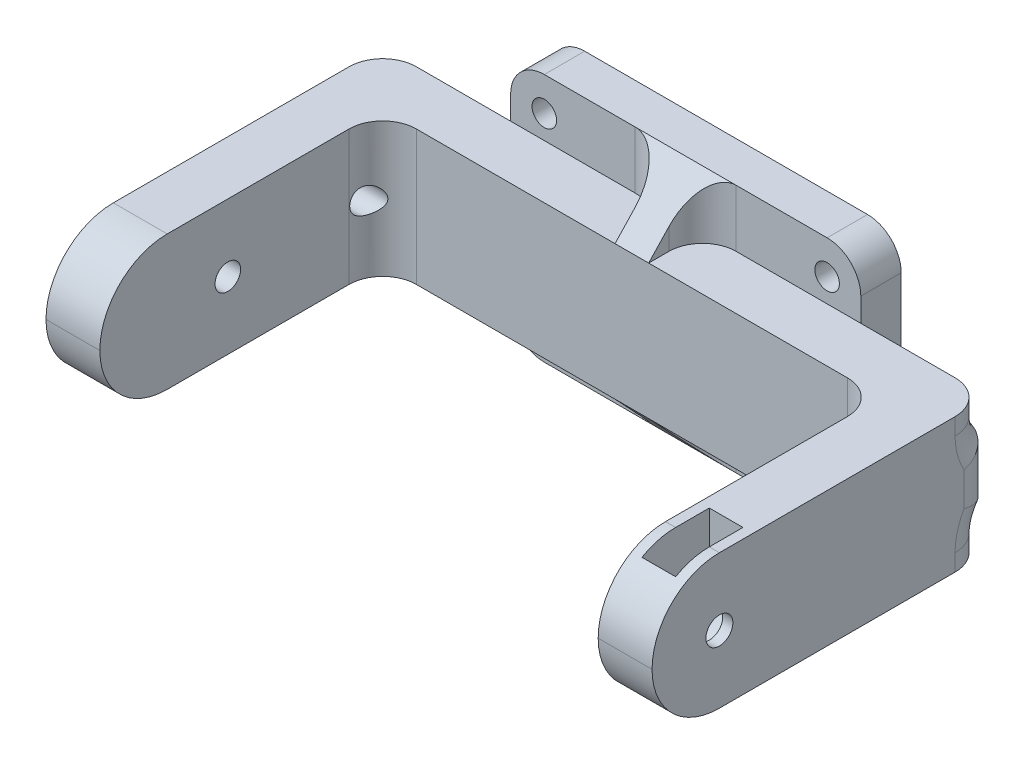
from build123d import *

# Parameters (mm, degrees)
BOSS_EXTRU_1_DEPTH      = 5
ESQUISSE4_W             = 2.5
ESQUISSE4_H             = 5
ENL_V_MAT_EXTRU_1_DEPTH = 7.5
ENL_V_MAT_EXTRU_2_REACH = 51.497
ESQUISSE5_R             = 1
CONG_1_R                = 2.5
CONG_2_R                = 5
ESQUISSE6_W             = 26
ESQUISSE6_H             = 18.5
ESQUISSE6_R             = 0.91
BOSS_EXTRU_2_DEPTH      = 3
NERVURE4_REACH          = 35.479
ESQUISSE7_WALL_W        = 74.793384568
ESQUISSE7_WALL_H        = 2.5
NERVURE5_REACH          = 35.479
ESQUISSE8_WALL_W        = 78.919505224
ESQUISSE8_WALL_H        = 2.5
CONG_3_R                = 2.5
CONG_4_START            = -2.015218214
CONG_4_3_DEPTH          = 4.030436428
CONG_4_START_2          = 3.7499999
CONG_4_4_DEPTH          = 1.2500001
CONG_4_START_3          = -5
CONG_4_5_DEPTH          = 1.25
CONG_4_6_DEPTH          = 10
ENL_V_MAT_EXTRU_3_REACH = 53.377
ESQUISSE9_R             = 0.95


with BuildPart() as part:
    # Esquisse2 → Boss.-Extru.1 (new, symmetric)
    with BuildSketch(Plane(origin=(0, 0, 0), x_dir=(1, 0, 0), z_dir=(0, 1, 0))):
        Polygon((-18.5, -5), (-18.5, 16), (18.5, 16), (18.5, -5), (22.5, -5), (22.5, 20), (-22.5, 20), (-22.5, -5), align=None)
    extrude(amount=BOSS_EXTRU_1_DEPTH, both=True)

    # Esquisse4 → Enlèv. mat.-Extru.1 (cut)
    with BuildSketch(Plane(origin=(0, 5, 0), x_dir=(1, 0, 0), z_dir=(0, 1, 0))):
        with Locations((20.5, 0)):
            Rectangle(ESQUISSE4_W, ESQUISSE4_H)
    extrude(amount=-ENL_V_MAT_EXTRU_1_DEPTH, mode=Mode.SUBTRACT)

    # Enlèv. mat.-Extru.2: up to this face of the body (flat: up to its plane)
    enl_v_mat_extru_2_end = Plane(part.part.faces().sort_by_distance((18.5, 0, -5.5))[0])
    # Esquisse5 → Enlèv. mat.-Extru.2 (cut, up to the picked face)
    with BuildSketch(Plane(origin=(22.5, 0, 0), x_dir=(0, 0, -1), z_dir=(1, 0, 0)), mode=Mode.PRIVATE) as enl_v_mat_extru_2_sk1:
        Circle(ESQUISSE5_R)
    enl_v_mat_extru_2_tool1 = split(extrude(enl_v_mat_extru_2_sk1.sketch, amount=-ENL_V_MAT_EXTRU_2_REACH, mode=Mode.PRIVATE), bisect_by=enl_v_mat_extru_2_end, keep=Keep.BOTH, mode=Mode.PRIVATE)
    add(enl_v_mat_extru_2_tool1.solids().sort_by(Axis((22.5, 0, 0), (-1, 0, 0)))[0], mode=Mode.SUBTRACT)

    # Congé1
    cong_1_edges = [part.edges().sort_by_distance(p)[0] for p in [
        (20.5, -2.5, 2.5),
        (20.5, -2.5, -2.5),
    ]]
    fillet(cong_1_edges, radius=CONG_1_R - 0.0001)  # a hair under: the kernel refuses the full size

    # Congé2
    # the kernel refuses this fillet: 5 mm, written as the material it takes off along each edge
    with BuildSketch(Plane(origin=(-35, -5, 5), x_dir=(0, 1, 0), z_dir=(1, 0, 0)), Plane(origin=(-35, 5, 5), x_dir=(0, 0, -1), z_dir=(1, 0, 0)), Plane(origin=(6, -5, 5), x_dir=(0, 1, 0), z_dir=(1, 0, 0)), Plane(origin=(6, 5, 5), x_dir=(0, 0, -1), z_dir=(1, 0, 0))) as cong_2_piece_1:
        with BuildLine():
            CenterArc((CONG_2_R, -CONG_2_R), CONG_2_R, 90, 90)
            Line((0, -CONG_2_R), (0, 0))
            Line((0, 0), (CONG_2_R, 0))
        make_face()
    extrude(amount=29, mode=Mode.SUBTRACT)

    # Esquisse6 → Boss.-Extru.2 (add)
    with BuildSketch(Plane(origin=(0, 0, -20), x_dir=(-1, 0, 0), z_dir=(0, 0, -1))):
        Rectangle(ESQUISSE6_W, ESQUISSE6_H)
        with Locations((-10.5, 6.75)):
            Circle(ESQUISSE6_R, mode=Mode.SUBTRACT)
        with Locations((10.5, 6.75)):
            Circle(ESQUISSE6_R, mode=Mode.SUBTRACT)
        with Locations((10.5, -6.75)):
            Circle(ESQUISSE6_R, mode=Mode.SUBTRACT)
        with Locations((-10.5, -6.75)):
            Circle(ESQUISSE6_R, mode=Mode.SUBTRACT)
    extrude(amount=BOSS_EXTRU_2_DEPTH)

    # Esquisse7 wall → Nervure4 (add, up to next)
    with BuildSketch(Plane(origin=(0, 7.125, -18), x_dir=(0, -0.728199992693, 0.685364699005), z_dir=(0, -0.685364699005, -0.728199992693)), mode=Mode.PRIVATE) as nervure4_sk1:
        Rectangle(ESQUISSE7_WALL_W, ESQUISSE7_WALL_H)
    nervure4_tool1 = extrude(nervure4_sk1.sketch, amount=NERVURE4_REACH, mode=Mode.PRIVATE) - part.part
    nervure4 = nervure4_tool1.solids().sort_by_distance((0, 7.125, -18))[0]
    add(nervure4)

    # Symétrie1: Nervure4 across plane
    add(nervure4.mirror(Plane.ZX))

    # Esquisse8 wall → Nervure5 (add, up to next)
    with BuildSketch(Plane(origin=(17.75, 0, -21.5), x_dir=(0.953582665134, 0, 0.301131367937), z_dir=(0.301131367937, 0, -0.953582665134)), mode=Mode.PRIVATE) as nervure5_sk1:
        Rectangle(ESQUISSE8_WALL_W, ESQUISSE8_WALL_H)
    nervure5_tool1 = extrude(nervure5_sk1.sketch, amount=-NERVURE5_REACH, mode=Mode.PRIVATE) - part.part
    nervure5 = nervure5_tool1.solids().sort_by_distance((17.75, 0, -21.5))[0]
    add(nervure5)

    # Symétrie2: Nervure5 across plane
    add(nervure5.mirror(Plane(origin=(0, 0, 0), x_dir=(0, 0, 1), z_dir=(1, 0, 0))))

    # Congé3
    cong_3_edges = [part.edges().sort_by_distance(p)[0] for p in [
        (1.25, 7.125, -20),
        (-1.25, 7.125, -20),
        (-1.25, -7.125, -20),
        (1.25, -7.125, -20),
        (17.75, 1.25, -20),
        (17.75, -1.25, -20),
        (-17.75, -1.25, -20),
        (-17.75, 1.25, -20),
        (-13, -9.25, -21.5),
        (-13, 9.25, -21.5),
        (13, 9.25, -21.5),
        (13, -9.25, -21.5),
    ]]
    fillet(cong_3_edges, radius=CONG_3_R)

    # Congé4: read off the stored shape, not the designer's step
    # Congé4 outline → Congé4 (revolve, cut)
    with BuildSketch(Plane(origin=(0, 3.75, -22.5), x_dir=(0, 1, 0), z_dir=(0, 0, -1))):
        with BuildLine():
            Line((2.5, 22.5), (2.5, 20))
            ThreePointArc((2.5, 20), (3.232233047, 21.767766953), (5, 22.5))
            Line((5, 22.5), (2.5, 22.5))
        make_face()
        with BuildLine():
            ThreePointArc((5, -22.5), (3.232233047, -21.767766953), (2.5, -20))
            Line((2.5, -20), (2.5, -22.5))
            Line((2.5, -22.5), (5, -22.5))
        make_face()
    revolve(axis=Axis((0, 3.75, -22.5), (1, 0, 0)), mode=Mode.SUBTRACT)

    # Cong_4 2 outline → Cong_4 2 (revolve, cut)
    with BuildSketch(Plane(origin=(0, -3.75, -22.5), x_dir=(0, 1, 0), z_dir=(0, 0, -1))):
        with BuildLine():
            Line((2.5, 22.5), (2.5, 20))
            ThreePointArc((2.5, 20), (3.232233047, 21.767766953), (5, 22.5))
            Line((5, 22.5), (2.5, 22.5))
        make_face()
        with BuildLine():
            ThreePointArc((5, -22.5), (3.232233047, -21.767766953), (2.5, -20))
            Line((2.5, -20), (2.5, -22.5))
            Line((2.5, -22.5), (5, -22.5))
        make_face()
    revolve(axis=Axis((0, -3.75, -22.5), (1, 0, 0)), mode=Mode.SUBTRACT)

    # Cong_4 3 outline → Cong_4 3 (cut)
    with BuildSketch(Plane(origin=(0, 0, 0), x_dir=(1, 0, 0), z_dir=(0, 1, 0)).offset(CONG_4_START)):
        with BuildLine():
            Line((22.5, 18.167781731), (22.5, 15.999999998))
            Line((22.5, 15.999999998), (24, 15.999999998))
            Line((24, 15.999999998), (24, 19.52631579))
            Line((24, 19.52631579), (22.449089048, 20.016077143))
            Line((22.449089048, 20.016077143), (20.75282842, 20.551738394))
            ThreePointArc((20.75282842, 20.551738394), (22.016441302, 19.645605968), (22.5, 18.167781731))
        make_face()
        with BuildLine():
            Line((-24, 15.999999998), (-22.5, 15.999999998))
            Line((-22.5, 15.999999998), (-22.5, 18.167781731))
            ThreePointArc((-22.5, 18.167781731), (-22.016441302, 19.645605968), (-20.75282842, 20.551738394))
            Line((-20.75282842, 20.551738394), (-22.449089048, 20.016077143))
            Line((-22.449089048, 20.016077143), (-24, 19.52631579))
            Line((-24, 19.52631579), (-24, 15.999999998))
        make_face()
    extrude(amount=CONG_4_3_DEPTH, mode=Mode.SUBTRACT)

    # Cong_4 4 outline → Cong_4 4 (cut)
    with BuildSketch(Plane(origin=(0, 0, 0), x_dir=(1, 0, 0), z_dir=(0, 1, 0)).offset(CONG_4_START_2)):
        with BuildLine():
            Line((18.5, 20), (20, 20))
            ThreePointArc((20, 20), (21.767766953, 19.267766953), (22.5, 17.5))
            Line((22.5, 17.5), (22.5, 18.167781731))
            ThreePointArc((22.5, 18.167781731), (22.016441302, 19.645605968), (20.75282842, 20.551738394))
            Line((20.75282842, 20.551738394), (18.5, 21.263157895))
            Line((18.5, 21.263157895), (18.5, 20))
        make_face()
        with BuildLine():
            Line((-18.5, 20), (-18.5, 21.263157895))
            Line((-18.5, 21.263157895), (-20.75282842, 20.551738394))
            ThreePointArc((-20.75282842, 20.551738394), (-22.016441302, 19.645605968), (-22.5, 18.167781731))
            Line((-22.5, 18.167781731), (-22.5, 17.5))
            ThreePointArc((-22.5, 17.5), (-21.767766953, 19.267766953), (-20, 20))
            Line((-20, 20), (-18.5, 20))
        make_face()
    extrude(amount=CONG_4_4_DEPTH, mode=Mode.SUBTRACT)

    # Cong_4 5 outline → Cong_4 5 (cut)
    with BuildSketch(Plane(origin=(0, 0, 0), x_dir=(1, 0, 0), z_dir=(0, 1, 0)).offset(CONG_4_START_3)):
        with BuildLine():
            Line((18.5, 20), (20, 20))
            ThreePointArc((20, 20), (21.767766953, 19.267766953), (22.5, 17.5))
            Line((22.5, 17.5), (22.5, 18.167781731))
            ThreePointArc((22.5, 18.167781731), (22.016441302, 19.645605968), (20.75282842, 20.551738394))
            Line((20.75282842, 20.551738394), (18.5, 21.263157895))
            Line((18.5, 21.263157895), (18.5, 20))
        make_face()
        with BuildLine():
            Line((-18.5, 20), (-18.5, 21.263157895))
            Line((-18.5, 21.263157895), (-20.75282842, 20.551738394))
            ThreePointArc((-20.75282842, 20.551738394), (-22.016441302, 19.645605968), (-22.5, 18.167781731))
            Line((-22.5, 18.167781731), (-22.5, 17.5))
            ThreePointArc((-22.5, 17.5), (-21.767766953, 19.267766953), (-20, 20))
            Line((-20, 20), (-18.5, 20))
        make_face()
    extrude(amount=CONG_4_5_DEPTH, mode=Mode.SUBTRACT)

    # Cong_4 6 outline → Cong_4 6 (add)
    with BuildSketch(Plane(origin=(0, 0, 0), x_dir=(1, 0, 0), z_dir=(0, 1, 0)).offset(CONG_4_START_3)):
        with BuildLine():
            Line((18.5, 13.5), (18.5, 16))
            Line((18.5, 16), (16, 16))
            ThreePointArc((16, 16), (17.767766953, 15.267766953), (18.5, 13.5))
        make_face()
        with BuildLine():
            ThreePointArc((-18.5, 13.5), (-17.767766953, 15.267766953), (-16, 16))
            Line((-16, 16), (-18.5, 15.999999998))
            Line((-18.5, 15.999999998), (-18.5, 13.5))
        make_face()
    extrude(amount=CONG_4_6_DEPTH)

    # Esquisse9 → Enlèv. mat.-Extru.3 (cut, up to next)
    with BuildSketch(Plane.ZY.offset(22.5), mode=Mode.PRIVATE) as enl_v_mat_extru_3_sk1:
        with Locations((-4.5, 0)):
            Circle(ESQUISSE9_R)
    enl_v_mat_extru_3_tool1 = extrude(enl_v_mat_extru_3_sk1.sketch, amount=-ENL_V_MAT_EXTRU_3_REACH, mode=Mode.PRIVATE) & part.part
    # Esquisse9 → Enlèv. mat.-Extru.3 (cut, up to next)
    with BuildSketch(Plane.ZY.offset(22.5), mode=Mode.PRIVATE) as enl_v_mat_extru_3_sk2:
        with Locations((-14.5, 0)):
            Circle(ESQUISSE9_R)
    enl_v_mat_extru_3_tool2 = extrude(enl_v_mat_extru_3_sk2.sketch, amount=-ENL_V_MAT_EXTRU_3_REACH, mode=Mode.PRIVATE) & part.part
    add(enl_v_mat_extru_3_tool1.solids().sort_by_distance((-22.5, 0, -4.5))[0], mode=Mode.SUBTRACT)
    add(enl_v_mat_extru_3_tool2.solids().sort_by_distance((-22.5, 0, -14.5))[0], mode=Mode.SUBTRACT)


solid = part.part
